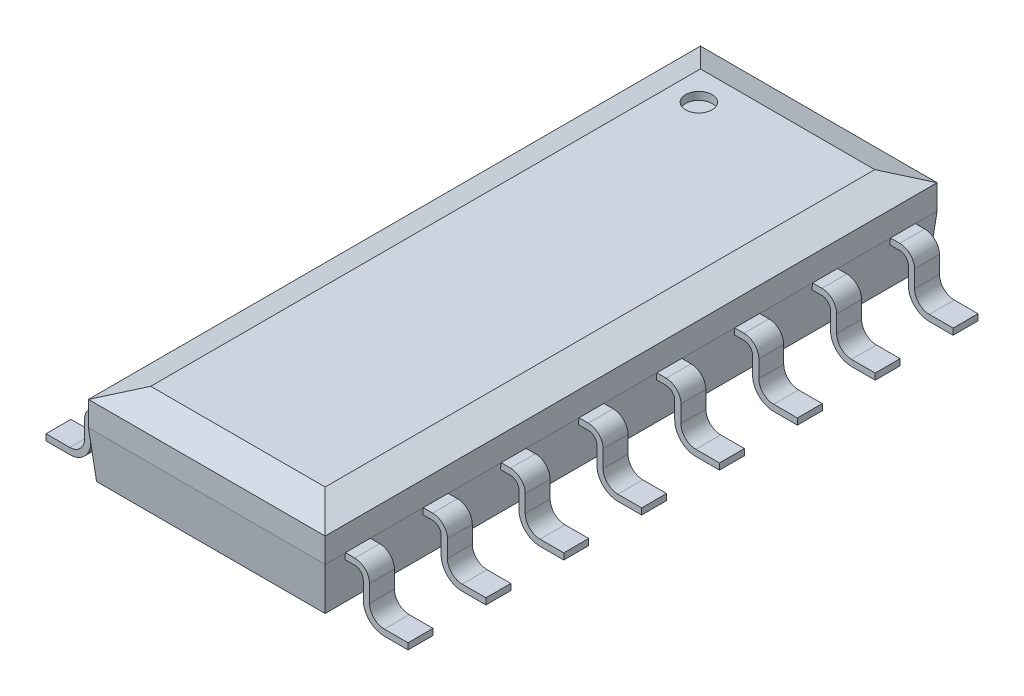
from build123d import *
from OCP.BRepFilletAPI import BRepFilletAPI_MakeChamfer

# Parameters (mm, degrees)
SKETCH1_W                = 9.9822
SKETCH1_H                = 1.3462
BASE_EXTRUDE_DEPTH       = 3.8608
CHAMFER1_SIZE            = 0.508
CHAMFER1_SIZE2           = 0.184896879
CHAMFER2_SIZE            = 0.762
CHAMFER2_SIZE2           = 0.066666362
SKETCH2_R                = 0.2159
CUT_EXTRUDE1_DEPTH       = 0.127
BOSS_EXTRUDE_THIN1_DEPTH = 0.2032
LPATTERN1_COUNT          = 8
LPATTERN1_PITCH          = 1.27
MIRROR1_COPY_1_DEPTH     = 0.2032
MIRROR1_COPY_2_DEPTH     = 0.2032
MIRROR1_COPY_3_DEPTH     = 0.2032
MIRROR1_COPY_4_DEPTH     = 0.2032
MIRROR1_COPY_5_DEPTH     = 0.2032
MIRROR1_COPY_6_DEPTH     = 0.2032
MIRROR1_COPY_7_DEPTH     = 0.2032
MIRROR1_COPY_8_DEPTH     = 0.2032


with BuildPart() as part:
    # Sketch1 → Base-Extrude (new body)
    with BuildSketch(Plane(origin=(0.762, 0, 0), x_dir=(0, 0, -1), z_dir=(1, 0, 0))):
        with Locations((-4.4323, 0.7747)):
            Rectangle(SKETCH1_W, SKETCH1_H)
    extrude(amount=BASE_EXTRUDE_DEPTH)

    # Chamfer1
    chamfer1_edges = [part.edges().sort_by_distance(p)[0] for p in [
        (2.6924, 1.4478, -0.5588),
        (4.6228, 1.4478, 4.4323),
        (2.6924, 1.4478, 9.4234),
        (0.762, 1.4478, 4.4323),
    ]]
    chamfer1_side = [part.faces().sort_by_distance(p)[0] for p in [
        (2.6924, 1.4478, 4.4323),
    ]]
    chamfer(chamfer1_edges, length=CHAMFER1_SIZE, length2=CHAMFER1_SIZE2, reference=chamfer1_side[0])

    # Chamfer2: one chamfer whose edges measure the first distance from different faces: ONE call of the kernel's chamfer builder (chamfer() names one face for all edges)
    chamfer2_edges_1 = [part.edges().sort_by_distance(p)[0] for p in [
        (2.6924, 0.1016, 9.4234),
    ]]
    chamfer2_side_1 = [part.faces().sort_by_distance(p)[0] for p in [
        (2.6924, 0.68225156, 9.4234),
    ]]
    chamfer2_edges_2 = [part.edges().sort_by_distance(p)[0] for p in [
        (4.6228, 0.1016, 4.4323),
    ]]
    chamfer2_side_2 = [part.faces().sort_by_distance(p)[0] for p in [
        (4.6228, 0.68225156, 4.4323),
    ]]
    chamfer2_edges_3 = [part.edges().sort_by_distance(p)[0] for p in [
        (2.6924, 0.1016, -0.5588),
    ]]
    chamfer2_side_3 = [part.faces().sort_by_distance(p)[0] for p in [
        (2.6924, 0.68225156, -0.5588),
    ]]
    chamfer2_edges_4 = [part.edges().sort_by_distance(p)[0] for p in [
        (0.762, 0.1016, 4.4323),
    ]]
    chamfer2_side_4 = [part.faces().sort_by_distance(p)[0] for p in [
        (0.762, 0.68225156, 4.4323),
    ]]
    chamfer2 = BRepFilletAPI_MakeChamfer(part.part.solid().wrapped)
    for e in chamfer2_edges_1:
        chamfer2.Add(CHAMFER2_SIZE, CHAMFER2_SIZE2, e.wrapped, chamfer2_side_1[0].wrapped)  # the first distance lies on this face
    for e in chamfer2_edges_2:
        chamfer2.Add(CHAMFER2_SIZE, CHAMFER2_SIZE2, e.wrapped, chamfer2_side_2[0].wrapped)  # the first distance lies on this face
    for e in chamfer2_edges_3:
        chamfer2.Add(CHAMFER2_SIZE, CHAMFER2_SIZE2, e.wrapped, chamfer2_side_3[0].wrapped)  # the first distance lies on this face
    for e in chamfer2_edges_4:
        chamfer2.Add(CHAMFER2_SIZE, CHAMFER2_SIZE2, e.wrapped, chamfer2_side_4[0].wrapped)  # the first distance lies on this face
    add(Compound.cast(chamfer2.Shape()), mode=Mode.REPLACE)

    # Sketch2 → Cut-Extrude1 (cut)
    with BuildSketch(Plane(origin=(0, 1.4478, 0), x_dir=(-1, 0, 0), z_dir=(0, 1, 0))):
        with Locations((-1.7272, 0.4318)):
            Circle(SKETCH2_R)
    extrude(amount=-CUT_EXTRUDE1_DEPTH, mode=Mode.SUBTRACT)

    # Sketch3 → Boss-Extrude-Thin1 (add, symmetric)
    with BuildSketch(Plane.XY):
        with BuildLine():
            Line((1.452090171, 0.8636), (0.6096, 0.8636))
            ThreePointArc((0.6096, 0.8636), (0.438975134, 0.792924866), (0.3683, 0.6223))
            Line((0.3683, 0.6223), (0.3683, 0.3429))
            ThreePointArc((0.3683, 0.3429), (0.297624866, 0.172275134), (0.127, 0.1016))
            Line((0.127, 0.1016), (-0.260272549, 0.1016))
            Line((-0.260272549, 0.1016), (-0.260272549, 0))
            Line((-0.260272549, 0), (0.127, 0))
            ThreePointArc((0.127, 0), (0.369466915, 0.100433085), (0.4699, 0.3429))
            Line((0.4699, 0.3429), (0.4699, 0.6223))
            ThreePointArc((0.4699, 0.6223), (0.510817183, 0.721082817), (0.6096, 0.762))
            Line((0.6096, 0.762), (1.452090171, 0.762))
            Line((1.452090171, 0.762), (1.452090171, 0.8636))
        make_face()
    boss_extrude_thin1 = extrude(amount=BOSS_EXTRUDE_THIN1_DEPTH, both=True)

    # LPattern1: Boss-Extrude-Thin1 ×8
    with Locations(*[(0, 0, i * LPATTERN1_PITCH) for i in range(1, LPATTERN1_COUNT)]):
        add(boss_extrude_thin1)

    # Mirror1 copy 1 sketch → Mirror1 copy 1 (add, symmetric)
    with BuildSketch(Plane(origin=(5.3848, 0, 1.27), x_dir=(-1, 0, 0), z_dir=(0, 0, 1))):
        with BuildLine():
            Line((1.452090171, -0.8636), (0.6096, -0.8636))
            ThreePointArc((0.6096, -0.8636), (0.438975134, -0.792924866), (0.3683, -0.6223))
            Line((0.3683, -0.6223), (0.3683, -0.3429))
            ThreePointArc((0.3683, -0.3429), (0.297624866, -0.172275134), (0.127, -0.1016))
            Line((0.127, -0.1016), (-0.260272549, -0.1016))
            Line((-0.260272549, -0.1016), (-0.260272549, 0))
            Line((-0.260272549, 0), (0.127, 0))
            ThreePointArc((0.127, 0), (0.369466915, -0.100433085), (0.4699, -0.3429))
            Line((0.4699, -0.3429), (0.4699, -0.6223))
            ThreePointArc((0.4699, -0.6223), (0.510817183, -0.721082817), (0.6096, -0.762))
            Line((0.6096, -0.762), (1.452090171, -0.762))
            Line((1.452090171, -0.762), (1.452090171, -0.8636))
        make_face()
    extrude(amount=MIRROR1_COPY_1_DEPTH, both=True)

    # Mirror1 copy 2 sketch → Mirror1 copy 2 (add, symmetric)
    with BuildSketch(Plane(origin=(5.3848, 0, 2.54), x_dir=(-1, 0, 0), z_dir=(0, 0, 1))):
        with BuildLine():
            Line((1.452090171, -0.8636), (0.6096, -0.8636))
            ThreePointArc((0.6096, -0.8636), (0.438975134, -0.792924866), (0.3683, -0.6223))
            Line((0.3683, -0.6223), (0.3683, -0.3429))
            ThreePointArc((0.3683, -0.3429), (0.297624866, -0.172275134), (0.127, -0.1016))
            Line((0.127, -0.1016), (-0.260272549, -0.1016))
            Line((-0.260272549, -0.1016), (-0.260272549, 0))
            Line((-0.260272549, 0), (0.127, 0))
            ThreePointArc((0.127, 0), (0.369466915, -0.100433085), (0.4699, -0.3429))
            Line((0.4699, -0.3429), (0.4699, -0.6223))
            ThreePointArc((0.4699, -0.6223), (0.510817183, -0.721082817), (0.6096, -0.762))
            Line((0.6096, -0.762), (1.452090171, -0.762))
            Line((1.452090171, -0.762), (1.452090171, -0.8636))
        make_face()
    extrude(amount=MIRROR1_COPY_2_DEPTH, both=True)

    # Mirror1 copy 3 sketch → Mirror1 copy 3 (add, symmetric)
    with BuildSketch(Plane(origin=(5.3848, 0, 3.81), x_dir=(-1, 0, 0), z_dir=(0, 0, 1))):
        with BuildLine():
            Line((1.452090171, -0.8636), (0.6096, -0.8636))
            ThreePointArc((0.6096, -0.8636), (0.438975134, -0.792924866), (0.3683, -0.6223))
            Line((0.3683, -0.6223), (0.3683, -0.3429))
            ThreePointArc((0.3683, -0.3429), (0.297624866, -0.172275134), (0.127, -0.1016))
            Line((0.127, -0.1016), (-0.260272549, -0.1016))
            Line((-0.260272549, -0.1016), (-0.260272549, 0))
            Line((-0.260272549, 0), (0.127, 0))
            ThreePointArc((0.127, 0), (0.369466915, -0.100433085), (0.4699, -0.3429))
            Line((0.4699, -0.3429), (0.4699, -0.6223))
            ThreePointArc((0.4699, -0.6223), (0.510817183, -0.721082817), (0.6096, -0.762))
            Line((0.6096, -0.762), (1.452090171, -0.762))
            Line((1.452090171, -0.762), (1.452090171, -0.8636))
        make_face()
    extrude(amount=MIRROR1_COPY_3_DEPTH, both=True)

    # Mirror1 copy 4 sketch → Mirror1 copy 4 (add, symmetric)
    with BuildSketch(Plane(origin=(5.3848, 0, 5.08), x_dir=(-1, 0, 0), z_dir=(0, 0, 1))):
        with BuildLine():
            Line((1.452090171, -0.8636), (0.6096, -0.8636))
            ThreePointArc((0.6096, -0.8636), (0.438975134, -0.792924866), (0.3683, -0.6223))
            Line((0.3683, -0.6223), (0.3683, -0.3429))
            ThreePointArc((0.3683, -0.3429), (0.297624866, -0.172275134), (0.127, -0.1016))
            Line((0.127, -0.1016), (-0.260272549, -0.1016))
            Line((-0.260272549, -0.1016), (-0.260272549, 0))
            Line((-0.260272549, 0), (0.127, 0))
            ThreePointArc((0.127, 0), (0.369466915, -0.100433085), (0.4699, -0.3429))
            Line((0.4699, -0.3429), (0.4699, -0.6223))
            ThreePointArc((0.4699, -0.6223), (0.510817183, -0.721082817), (0.6096, -0.762))
            Line((0.6096, -0.762), (1.452090171, -0.762))
            Line((1.452090171, -0.762), (1.452090171, -0.8636))
        make_face()
    extrude(amount=MIRROR1_COPY_4_DEPTH, both=True)

    # Mirror1 copy 5 sketch → Mirror1 copy 5 (add, symmetric)
    with BuildSketch(Plane(origin=(5.3848, 0, 6.35), x_dir=(-1, 0, 0), z_dir=(0, 0, 1))):
        with BuildLine():
            Line((1.452090171, -0.8636), (0.6096, -0.8636))
            ThreePointArc((0.6096, -0.8636), (0.438975134, -0.792924866), (0.3683, -0.6223))
            Line((0.3683, -0.6223), (0.3683, -0.3429))
            ThreePointArc((0.3683, -0.3429), (0.297624866, -0.172275134), (0.127, -0.1016))
            Line((0.127, -0.1016), (-0.260272549, -0.1016))
            Line((-0.260272549, -0.1016), (-0.260272549, 0))
            Line((-0.260272549, 0), (0.127, 0))
            ThreePointArc((0.127, 0), (0.369466915, -0.100433085), (0.4699, -0.3429))
            Line((0.4699, -0.3429), (0.4699, -0.6223))
            ThreePointArc((0.4699, -0.6223), (0.510817183, -0.721082817), (0.6096, -0.762))
            Line((0.6096, -0.762), (1.452090171, -0.762))
            Line((1.452090171, -0.762), (1.452090171, -0.8636))
        make_face()
    extrude(amount=MIRROR1_COPY_5_DEPTH, both=True)

    # Mirror1 copy 6 sketch → Mirror1 copy 6 (add, symmetric)
    with BuildSketch(Plane(origin=(5.3848, 0, 7.62), x_dir=(-1, 0, 0), z_dir=(0, 0, 1))):
        with BuildLine():
            Line((1.452090171, -0.8636), (0.6096, -0.8636))
            ThreePointArc((0.6096, -0.8636), (0.438975134, -0.792924866), (0.3683, -0.6223))
            Line((0.3683, -0.6223), (0.3683, -0.3429))
            ThreePointArc((0.3683, -0.3429), (0.297624866, -0.172275134), (0.127, -0.1016))
            Line((0.127, -0.1016), (-0.260272549, -0.1016))
            Line((-0.260272549, -0.1016), (-0.260272549, 0))
            Line((-0.260272549, 0), (0.127, 0))
            ThreePointArc((0.127, 0), (0.369466915, -0.100433085), (0.4699, -0.3429))
            Line((0.4699, -0.3429), (0.4699, -0.6223))
            ThreePointArc((0.4699, -0.6223), (0.510817183, -0.721082817), (0.6096, -0.762))
            Line((0.6096, -0.762), (1.452090171, -0.762))
            Line((1.452090171, -0.762), (1.452090171, -0.8636))
        make_face()
    extrude(amount=MIRROR1_COPY_6_DEPTH, both=True)

    # Mirror1 copy 7 sketch → Mirror1 copy 7 (add, symmetric)
    with BuildSketch(Plane(origin=(5.3848, 0, 8.89), x_dir=(-1, 0, 0), z_dir=(0, 0, 1))):
        with BuildLine():
            Line((1.452090171, -0.8636), (0.6096, -0.8636))
            ThreePointArc((0.6096, -0.8636), (0.438975134, -0.792924866), (0.3683, -0.6223))
            Line((0.3683, -0.6223), (0.3683, -0.3429))
            ThreePointArc((0.3683, -0.3429), (0.297624866, -0.172275134), (0.127, -0.1016))
            Line((0.127, -0.1016), (-0.260272549, -0.1016))
            Line((-0.260272549, -0.1016), (-0.260272549, 0))
            Line((-0.260272549, 0), (0.127, 0))
            ThreePointArc((0.127, 0), (0.369466915, -0.100433085), (0.4699, -0.3429))
            Line((0.4699, -0.3429), (0.4699, -0.6223))
            ThreePointArc((0.4699, -0.6223), (0.510817183, -0.721082817), (0.6096, -0.762))
            Line((0.6096, -0.762), (1.452090171, -0.762))
            Line((1.452090171, -0.762), (1.452090171, -0.8636))
        make_face()
    extrude(amount=MIRROR1_COPY_7_DEPTH, both=True)

    # Mirror1 copy 8 sketch → Mirror1 copy 8 (add, symmetric)
    with BuildSketch(Plane(origin=(5.3848, 0, 0), x_dir=(-1, 0, 0), z_dir=(0, 0, 1))):
        with BuildLine():
            Line((1.452090171, -0.8636), (0.6096, -0.8636))
            ThreePointArc((0.6096, -0.8636), (0.438975134, -0.792924866), (0.3683, -0.6223))
            Line((0.3683, -0.6223), (0.3683, -0.3429))
            ThreePointArc((0.3683, -0.3429), (0.297624866, -0.172275134), (0.127, -0.1016))
            Line((0.127, -0.1016), (-0.260272549, -0.1016))
            Line((-0.260272549, -0.1016), (-0.260272549, 0))
            Line((-0.260272549, 0), (0.127, 0))
            ThreePointArc((0.127, 0), (0.369466915, -0.100433085), (0.4699, -0.3429))
            Line((0.4699, -0.3429), (0.4699, -0.6223))
            ThreePointArc((0.4699, -0.6223), (0.510817183, -0.721082817), (0.6096, -0.762))
            Line((0.6096, -0.762), (1.452090171, -0.762))
            Line((1.452090171, -0.762), (1.452090171, -0.8636))
        make_face()
    extrude(amount=MIRROR1_COPY_8_DEPTH, both=True)


solid = part.part
